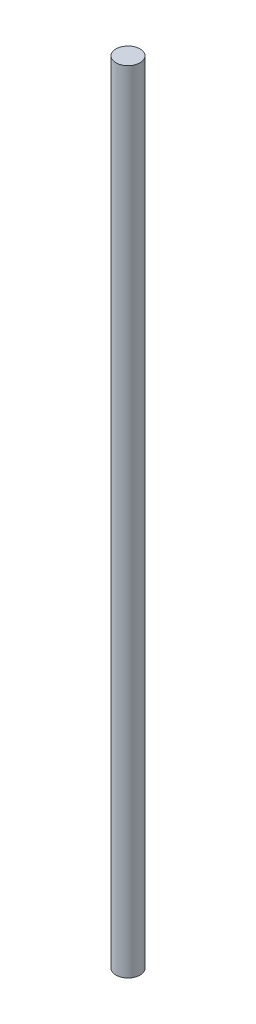
from build123d import *

# Parameters (mm, degrees)
SKETCH1_R           = 76.2
BOSS_EXTRUDE1_DEPTH = 5000


with BuildPart() as part:
    # Sketch1 → Boss-Extrude1 (new body)
    with BuildSketch(Plane(origin=(0, 0, 0), x_dir=(1, 0, 0), z_dir=(0, 1, 0))):
        Circle(SKETCH1_R)
    extrude(amount=BOSS_EXTRUDE1_DEPTH)


solid = part.part
